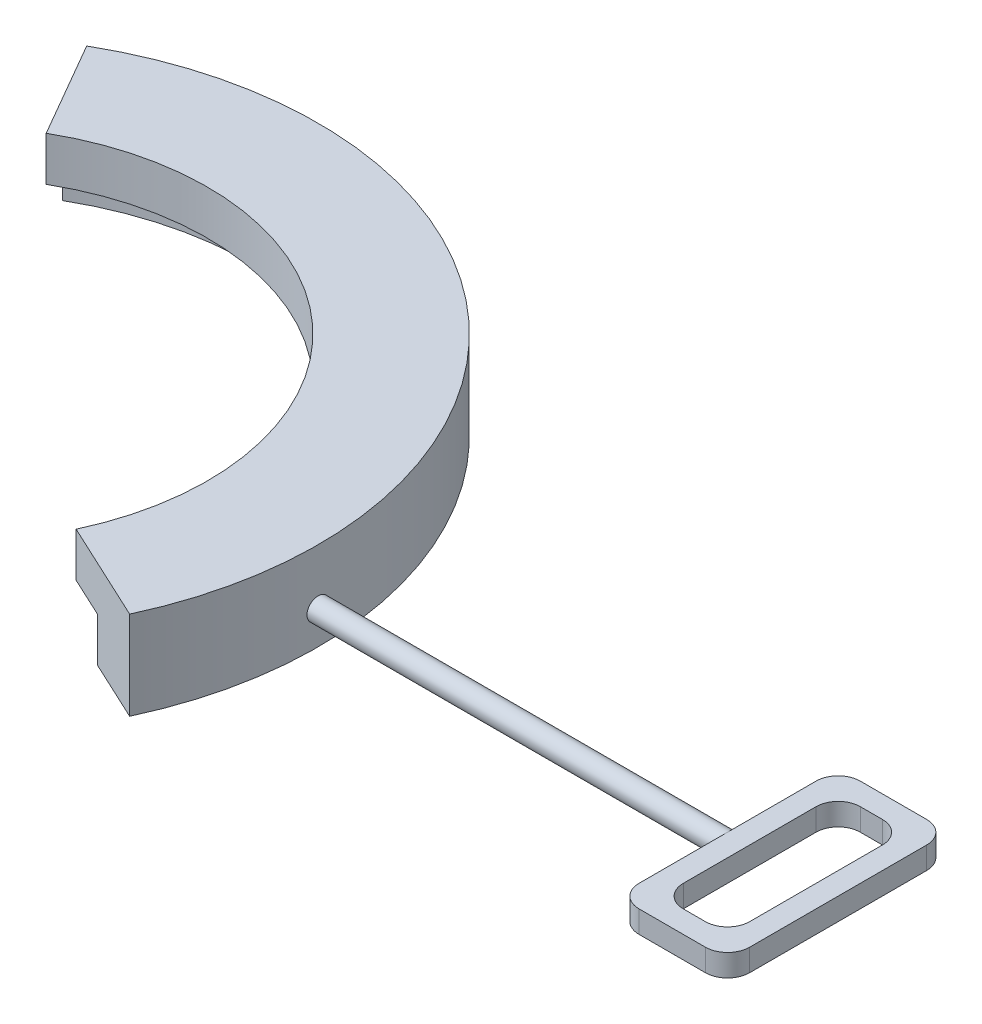
from build123d import *

# Parameters (mm, degrees)
BOSS_EXTRUDE1_DEPTH = 20
BOSS_EXTRUDE2_DEPTH = 20
SWEEP1_START        = 164
SWEEP1_OUTLINE_R    = 5
SWEEP1_DEPTH        = 186
SKETCH4_W           = 100
SKETCH4_H           = 10
BOSS_EXTRUDE3_DEPTH = 50
CUT_EXTRUDE1_DEPTH  = 50
FILLET1_START       = 10
FILLET1_DEPTH       = 10
FILLET1_2_DEPTH     = 10


with BuildPart() as part:
    # Sketch1 → Boss-Extrude1 (new body)
    with BuildSketch(Plane(origin=(0, 0, 0), x_dir=(1, 0, 0), z_dir=(0, 1, 0))):
        with BuildLine():
            Line((-82.5, 142.894191624), (-67.5, 116.913429511))
            ThreePointArc((-67.5, 116.913429511), (67.5, 116.913429511), (135, 0))
            ThreePointArc((135, 0), (131.799960961, -29.219347882), (122.35155125, -57.053465335))
            Line((122.35155125, -57.053465335), (149.540784861, -69.732013187))
            ThreePointArc((149.540784861, -69.732013187), (161.088841175, -35.7125363), (165, 0))
            ThreePointArc((165, 0), (82.5, 142.894191624), (-82.5, 142.894191624))
        make_face()
    extrude(amount=BOSS_EXTRUDE1_DEPTH)

    # Sketch2 → Boss-Extrude2 (add)
    with BuildSketch(Plane(origin=(0, 20, 0), x_dir=(1, 0, 0), z_dir=(0, 1, 0))):
        with BuildLine():
            ThreePointArc((122.35155125, -57.053465335), (91.204678028, 99.532440469), (-67.5, 116.913429511))
            Line((-67.5, 116.913429511), (-57.5, 99.592921435))
            ThreePointArc((-57.5, 99.592921435), (57.5, 99.592921435), (115, 0))
            ThreePointArc((115, 0), (112.274040819, -24.890555603), (104.225395509, -48.6011001))
            Line((104.225395509, -48.6011001), (122.35155125, -57.053465335))
        make_face()
        with BuildLine():
            Line((-82.5, 142.894191624), (-67.5, 116.913429511))
            ThreePointArc((-67.5, 116.913429511), (91.204678028, 99.532440469), (122.35155125, -57.053465335))
            Line((122.35155125, -57.053465335), (149.540784861, -69.732013187))
            ThreePointArc((149.540784861, -69.732013187), (111.472384257, 121.650760574), (-82.5, 142.894191624))
        make_face()
    extrude(amount=BOSS_EXTRUDE2_DEPTH)

    # Sweep1: read off the stored shape, not the designer's step
    # Sweep1 outline → Sweep1 (add)
    with BuildSketch(Plane.YZ.offset(SWEEP1_START)):
        with Locations((15, 0)):
            Circle(SWEEP1_OUTLINE_R)
    extrude(amount=SWEEP1_DEPTH)

    # Sketch4 → Boss-Extrude3 (add)
    with BuildSketch(Plane(origin=(350, 0, 0), x_dir=(1.4081184135372707e-12, 0, -1.0), z_dir=(1.0, 0, 1.4081184135372707e-12))):
        with Locations((0, 15)):
            Rectangle(SKETCH4_W, SKETCH4_H)
    extrude(amount=BOSS_EXTRUDE3_DEPTH)

    # Sketch5 → Cut-Extrude1 (cut)
    with BuildSketch(Plane(origin=(0, 20, 0), x_dir=(1, 0, 0), z_dir=(0, 1, 0))):
        Polygon((360, 40), (360, 0), (360, -40), (390, -40), (390, 40), align=None)
    extrude(amount=-CUT_EXTRUDE1_DEPTH, mode=Mode.SUBTRACT)

    # Fillet1: read off the stored shape, not the designer's step
    # Fillet1 outline → Fillet1 (cut)
    with BuildSketch(Plane(origin=(0, 0, 0), x_dir=(1, 0, 0), z_dir=(0, 1, 0)).offset(FILLET1_START)):
        with BuildLine():
            ThreePointArc((390, 50), (397.071067812, 47.071067812), (400, 40))
            Line((400, 40), (400, 50))
            Line((400, 50), (390, 50))
        make_face()
        with BuildLine():
            Line((400, -50), (400, -40))
            ThreePointArc((400, -40), (397.071067812, -47.071067812), (390, -50))
            Line((390, -50), (400, -50))
        make_face()
        with BuildLine():
            ThreePointArc((350, 40), (352.928932188, 47.071067812), (360, 50))
            Line((360, 50), (350, 50))
            Line((350, 50), (350, 40))
        make_face()
        with BuildLine():
            Line((350, -50), (360, -50))
            ThreePointArc((360, -50), (352.928932188, -47.071067812), (350, -40))
            Line((350, -40), (350, -50))
        make_face()
    extrude(amount=FILLET1_DEPTH, mode=Mode.SUBTRACT)

    # Fillet1 2 outline → Fillet1 2 (add)
    with BuildSketch(Plane(origin=(0, 0, 0), x_dir=(1, 0, 0), z_dir=(0, 1, 0)).offset(FILLET1_START)):
        with BuildLine():
            Line((390, -40), (390, -30))
            ThreePointArc((390, -30), (387.071067812, -37.071067812), (380, -40))
            Line((380, -40), (390, -40))
        make_face()
        with BuildLine():
            ThreePointArc((380, 40), (387.071067812, 37.071067812), (390, 30))
            Line((390, 30), (390, 40))
            Line((390, 40), (380, 40))
        make_face()
        with BuildLine():
            Line((360, -40), (370, -40))
            ThreePointArc((370, -40), (362.928932188, -37.071067812), (360, -30))
            Line((360, -30), (360, -40))
        make_face()
        with BuildLine():
            ThreePointArc((360, 30), (362.928932188, 37.071067812), (370, 40))
            Line((370, 40), (360, 40))
            Line((360, 40), (360, 30))
        make_face()
    extrude(amount=FILLET1_2_DEPTH)


solid = part.part
